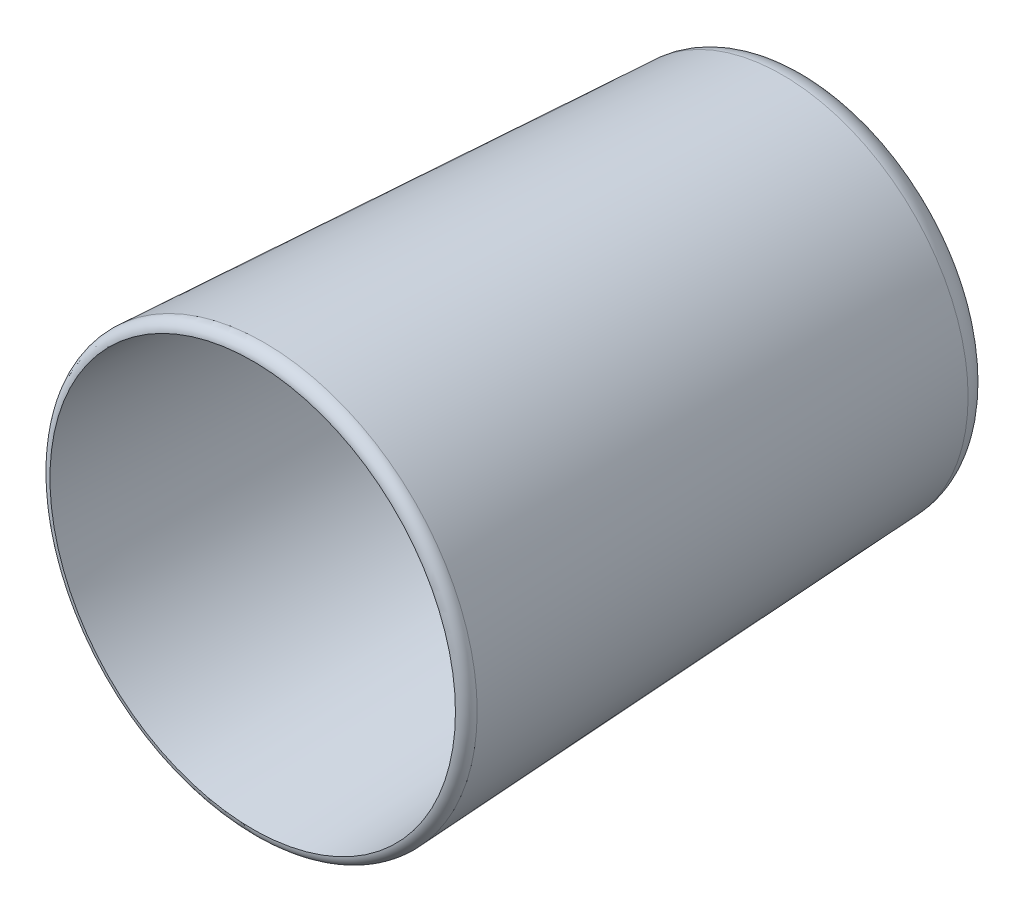
from build123d import *

# Parameters (mm, degrees)
ESQUISSE1_R        = 32
BOSS_EXTRU_1_DEPTH = 100
BOSS_EXTRU_1_DRAFT = -3
COQUE3_T           = 2
CONG_7_R           = 2


with BuildPart() as part:
    # Esquisse1 → Boss.-Extru.1 (with draft: the straight prism first)
    with BuildSketch(Plane.XY):
        Circle(ESQUISSE1_R)
    extrude(amount=BOSS_EXTRU_1_DEPTH)
    # Boss.-Extru.1: the draft: its side faces are tilted about the plane it starts from
    boss_extru_1_sides = [part.faces().sort_by_distance(p)[0] for p in [
        (-32, 0, 50),
    ]]
    draft(boss_extru_1_sides, Plane.XY, BOSS_EXTRU_1_DRAFT)

    # Coque3
    coque3_openings = [part.faces().sort_by_distance(p)[0] for p in [
        (0, 0, 100),
    ]]
    offset(amount=COQUE3_T, openings=coque3_openings, kind=Kind.INTERSECTION)

    # Congé6: read off the stored shape, not the designer's step
    # Congé6 outline → Congé6 (revolve, cut)
    with BuildSketch(Plane.XZ):
        with BuildLine():
            ThreePointArc((34.146253974, 2.738320219), (32.594879178, -0.626871855), (29.1531063, -2))
            Line((29.1531063, -2), (34.146253974, -2))
            Line((34.146253974, -2), (34.146253974, 2.738320219))
        make_face()
    revolve(axis=Axis((0, 0, 0), (0, 0, 1)), mode=Mode.SUBTRACT)

    # Congé7
    # the kernel refuses this fillet: 2 mm, written as the material it takes off along each edge
    with BuildSketch(Plane(origin=(0, 0, 100), x_dir=(1, 0, 0), z_dir=(0, 1, 0))) as cong_7_piece_1:
        with BuildLine():
            CenterArc((37.136106016, 1.99725907), CONG_7_R, 273, 90)
            Line((39.133365085, 2.101930982), (39.173310267, 2.10402442))
            Line((39.173310267, 2.10402442), (39.283467802, 0.002093438))
            Line((39.283467802, 0.002093438), (39.24352262, -0.04))
            ThreePointArc((39.24352262, -0.04), (38.242150274, -0.04), (37.242871367, -0.039945181))
            Line((37.242871367, -0.039945181), (37.240777928, 0))
        make_face()
    revolve(axis=Axis((0, 0, 100), (0, 0, -1)), mode=Mode.SUBTRACT)


solid = part.part
